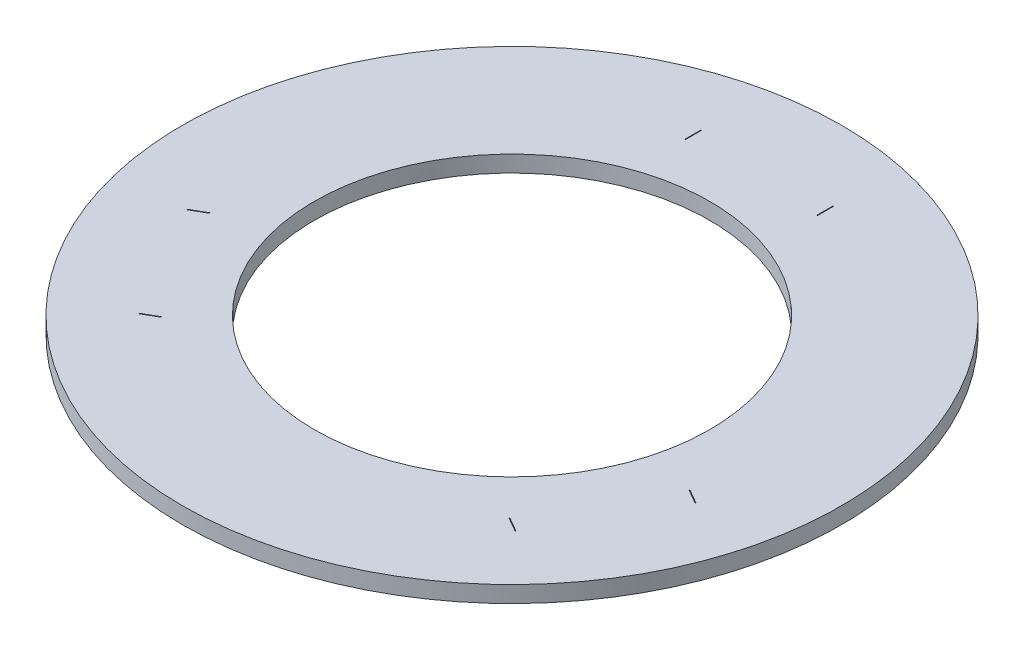
from build123d import *

# Parameters (mm, degrees)
SKETCH2_R           = 100
BOSS_EXTRUDE1_DEPTH = 5
SKETCH3_W           = 0.2
SKETCH3_H           = 5
CUT_EXTRUDE1_DEPTH  = 142.509716981
SKETCH4_R           = 60
CUT_EXTRUDE2_DEPTH  = 142.509716981


with BuildPart() as part:
    # Sketch2 → Boss-Extrude1 (new body)
    with BuildSketch(Plane(origin=(0, 0, 0), x_dir=(1, 0, 0), z_dir=(0, 1, 0))):
        Circle(SKETCH2_R)
    extrude(amount=BOSS_EXTRUDE1_DEPTH)

    # Sketch3 → Cut-Extrude1 (cut, through all)
    with BuildSketch(Plane(origin=(0, 5, 0), x_dir=(1, 0, 0), z_dir=(0, 1, 0))):
        Polygon((72.836841774, -18.842889384), (77.166968793, -21.342889384), (77.066968793, -21.516094465), (72.736841774, -19.016094465), align=None)
        with Locations((-20, 75)):
            Rectangle(SKETCH3_W, SKETCH3_H)
        with Locations((20, 75)):
            Rectangle(SKETCH3_W, SKETCH3_H)
        Polygon((52.836841774, -53.483905535), (57.166968793, -55.983905535), (57.066968793, -56.157110616), (52.736841774, -53.657110616), align=None)
        Polygon((-52.736841774, -53.657110616), (-57.066968793, -56.157110616), (-57.166968793, -55.983905535), (-52.836841774, -53.483905535), align=None)
        Polygon((-72.736841774, -19.016094465), (-77.066968793, -21.516094465), (-77.166968793, -21.342889384), (-72.836841774, -18.842889384), align=None)
    extrude(amount=-CUT_EXTRUDE1_DEPTH, mode=Mode.SUBTRACT)

    # Sketch4 → Cut-Extrude2 (cut, through all)
    with BuildSketch(Plane(origin=(0, 5, 0), x_dir=(1, 0, 0), z_dir=(0, 1, 0))):
        Circle(SKETCH4_R)
    extrude(amount=-CUT_EXTRUDE2_DEPTH, mode=Mode.SUBTRACT)


solid = part.part
